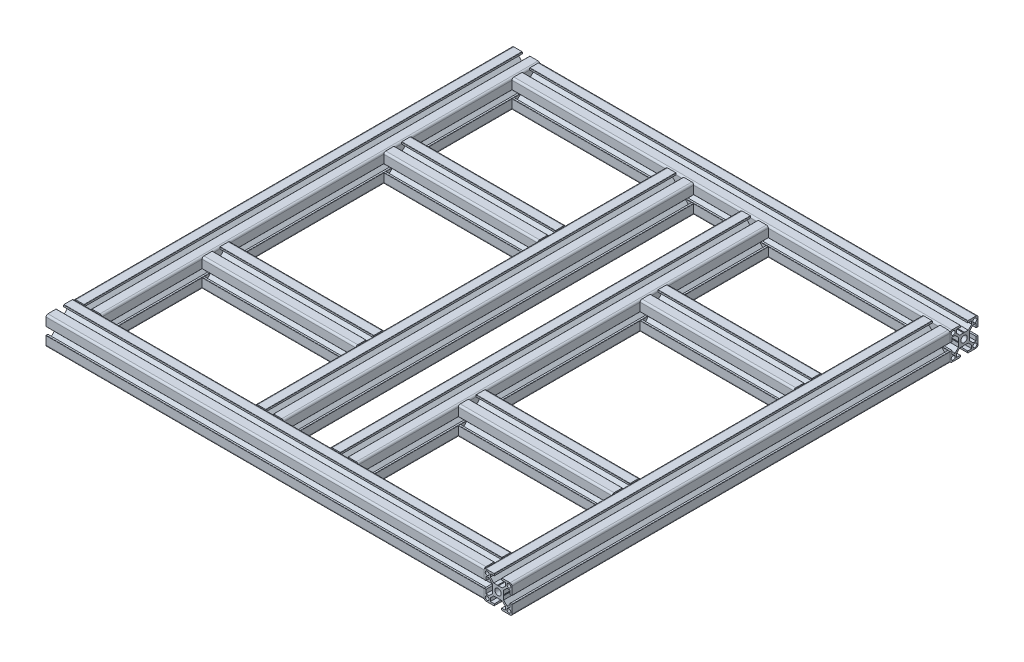
from build123d import *

# Parameters (mm, degrees)
F_30XS6_30X30S6_1_DEPTH      = 485
F_30XS6_30X30S6_1_DEPTH_BACK = 1
SKETCH_1_R                   = 2.1
SKETCH_1_R_2                 = 3.4
SKETCH_1_ON_SEGMENT_2_R      = 2.1
SKETCH_1_ON_SEGMENT_2_R_2    = 3.4
F_30XS6_30X30S6_1_2_DEPTH    = 486
SKETCH_1_ON_SEGMENT_3_R      = 2.1
SKETCH_1_ON_SEGMENT_3_R_2    = 3.4
F_30XS6_30X30S6_1_3_DEPTH    = 486
SKETCH_1_ON_SEGMENT_4_R      = 2.1
SKETCH_1_ON_SEGMENT_4_R_2    = 3.4
F_30XS6_30X30S6_1_4_DEPTH    = 486
SKETCH_1_ON_SEGMENT_5_R      = 2.1
SKETCH_1_ON_SEGMENT_5_R_2    = 3.4
F_30XS6_30X30S6_1_5_DEPTH    = 472
SKETCH_1_ON_SEGMENT_6_R      = 2.1
SKETCH_1_ON_SEGMENT_6_R_2    = 3.4
F_30XS6_30X30S6_1_6_DEPTH    = 472
SKETCH_1_ON_SEGMENT_7_R      = 2.1
SKETCH_1_ON_SEGMENT_7_R_2    = 3.4
F_30XS6_30X30S6_1_7_DEPTH    = 197
SKETCH_1_ON_SEGMENT_8_R      = 2.1
SKETCH_1_ON_SEGMENT_8_R_2    = 3.4
F_30XS6_30X30S6_1_8_DEPTH    = 197
SKETCH_1_ON_SEGMENT_9_R      = 2.1
SKETCH_1_ON_SEGMENT_9_R_2    = 3.4
F_30XS6_30X30S6_1_9_DEPTH    = 197
SKETCH_1_ON_SEGMENT_10_R     = 2.1
SKETCH_1_ON_SEGMENT_10_R_2   = 3.4
F_30XS6_30X30S6_1_10_DEPTH   = 197


with BuildPart() as part:
    # 草图1 → 30xs6 30X30S6(1) (new, two sides: drawn at the far end of the back side and taken through both)
    with BuildSketch(Plane(origin=(-235, 0, -235), x_dir=(0, 0, -1), z_dir=(1, 0, 0)).offset(-F_30XS6_30X30S6_1_DEPTH_BACK)):
        with BuildLine():
            Line((-14.7, 4), (-13, 4))
            Line((-13, 4), (-13, 8.25))
            Line((-13, 8.25), (-9.664213562, 8.25))
            Line((-9.664213562, 8.25), (-6, 4.585786438))
            Line((-6, 4.585786438), (-6, 0.519615242))
            Line((-6, 0.519615242), (-5.7, 0))
            Line((-5.7, 0), (-6, -0.519615242))
            Line((-6, -0.519615242), (-6, -4.585786438))
            Line((-6, -4.585786438), (-9.664213562, -8.25))
            Line((-9.664213562, -8.25), (-13, -8.25))
            Line((-13, -8.25), (-13, -4))
            Line((-13, -4), (-14.7, -4))
            ThreePointArc((-14.7, -4), (-14.912132034, -4.087867966), (-15, -4.3))
            Line((-15, -4.3), (-15, -13))
            ThreePointArc((-15, -13), (-14.414213562, -14.414213562), (-13, -15))
            Line((-13, -15), (-4.3, -15))
            ThreePointArc((-4.3, -15), (-4.087867966, -14.912132034), (-4, -14.7))
            Line((-4, -14.7), (-4, -13))
            Line((-4, -13), (-8.25, -13))
            Line((-8.25, -13), (-8.25, -9.664213562))
            Line((-8.25, -9.664213562), (-4.585786438, -6))
            Line((-4.585786438, -6), (-0.519615242, -6))
            Line((-0.519615242, -6), (0, -5.7))
            Line((0, -5.7), (0.519615242, -6))
            Line((0.519615242, -6), (4.585786438, -6))
            Line((4.585786438, -6), (8.25, -9.664213562))
            Line((8.25, -9.664213562), (8.25, -13))
            Line((8.25, -13), (4, -13))
            Line((4, -13), (4, -14.7))
            ThreePointArc((4, -14.7), (4.087867966, -14.912132034), (4.3, -15))
            Line((4.3, -15), (13, -15))
            ThreePointArc((13, -15), (14.414213562, -14.414213562), (15, -13))
            Line((15, -13), (15, -4.3))
            ThreePointArc((15, -4.3), (14.912132034, -4.087867966), (14.7, -4))
            Line((14.7, -4), (13, -4))
            Line((13, -4), (13, -8.25))
            Line((13, -8.25), (9.664213562, -8.25))
            Line((9.664213562, -8.25), (6, -4.585786438))
            Line((6, -4.585786438), (6, -0.519615242))
            Line((6, -0.519615242), (5.7, 0))
            Line((5.7, 0), (6, 0.519615242))
            Line((6, 0.519615242), (6, 4.585786438))
            Line((6, 4.585786438), (9.664213562, 8.25))
            Line((9.664213562, 8.25), (13, 8.25))
            Line((13, 8.25), (13, 4))
            Line((13, 4), (14.7, 4))
            ThreePointArc((14.7, 4), (14.912132034, 4.087867966), (15, 4.3))
            Line((15, 4.3), (15, 13))
            ThreePointArc((15, 13), (14.414213562, 14.414213562), (13, 15))
            Line((13, 15), (4.3, 15))
            ThreePointArc((4.3, 15), (4.087867966, 14.912132034), (4, 14.7))
            Line((4, 14.7), (4, 13))
            Line((4, 13), (8.25, 13))
            Line((8.25, 13), (8.25, 9.664213562))
            Line((8.25, 9.664213562), (4.585786438, 6))
            Line((4.585786438, 6), (0.519615242, 6))
            Line((0.519615242, 6), (0, 5.7))
            Line((0, 5.7), (-0.519615242, 6))
            Line((-0.519615242, 6), (-4.585786438, 6))
            Line((-4.585786438, 6), (-8.25, 9.664213562))
            Line((-8.25, 9.664213562), (-8.25, 13))
            Line((-8.25, 13), (-4, 13))
            Line((-4, 13), (-4, 14.7))
            ThreePointArc((-4, 14.7), (-4.087867966, 14.912132034), (-4.3, 15))
            Line((-4.3, 15), (-13, 15))
            ThreePointArc((-13, 15), (-14.414213562, 14.414213562), (-15, 13))
            Line((-15, 13), (-15, 4.3))
            ThreePointArc((-15, 4.3), (-14.912132034, 4.087867966), (-14.7, 4))
        make_face()
        with Locations((11.625, 11.625)):
            Circle(SKETCH_1_R, mode=Mode.SUBTRACT)
        with Locations((11.625, -11.625)):
            Circle(SKETCH_1_R, mode=Mode.SUBTRACT)
        Circle(SKETCH_1_R_2, mode=Mode.SUBTRACT)
        with Locations((-11.625, -11.625)):
            Circle(SKETCH_1_R, mode=Mode.SUBTRACT)
        with Locations((-11.625, 11.625)):
            Circle(SKETCH_1_R, mode=Mode.SUBTRACT)
    extrude(amount=F_30XS6_30X30S6_1_DEPTH + F_30XS6_30X30S6_1_DEPTH_BACK)

    # 30xs6 30X30S6(1) end butt 1
    split(bisect_by=Plane(origin=(-220, 0, -235), x_dir=(0, 1, 0), z_dir=(1, 0, 0)), keep=Keep.TOP)


with BuildPart() as body_2:
    # 草图1 on segment 2 (carried to segment 2) → 30xs6 30X30S6_1 2 (new body)
    with BuildSketch(Plane(origin=(235, 0, -236), x_dir=(1, 0, 0), z_dir=(0, 0, 1))):
        with BuildLine():
            Line((-14.7, 4), (-13, 4))
            Line((-13, 4), (-13, 8.25))
            Line((-13, 8.25), (-9.664213562, 8.25))
            Line((-9.664213562, 8.25), (-6, 4.585786438))
            Line((-6, 4.585786438), (-6, 0.519615242))
            Line((-6, 0.519615242), (-5.7, 0))
            Line((-5.7, 0), (-6, -0.519615242))
            Line((-6, -0.519615242), (-6, -4.585786438))
            Line((-6, -4.585786438), (-9.664213562, -8.25))
            Line((-9.664213562, -8.25), (-13, -8.25))
            Line((-13, -8.25), (-13, -4))
            Line((-13, -4), (-14.7, -4))
            ThreePointArc((-14.7, -4), (-14.912132034, -4.087867966), (-15, -4.3))
            Line((-15, -4.3), (-15, -13))
            ThreePointArc((-15, -13), (-14.414213562, -14.414213562), (-13, -15))
            Line((-13, -15), (-4.3, -15))
            ThreePointArc((-4.3, -15), (-4.087867966, -14.912132034), (-4, -14.7))
            Line((-4, -14.7), (-4, -13))
            Line((-4, -13), (-8.25, -13))
            Line((-8.25, -13), (-8.25, -9.664213562))
            Line((-8.25, -9.664213562), (-4.585786438, -6))
            Line((-4.585786438, -6), (-0.519615242, -6))
            Line((-0.519615242, -6), (0, -5.7))
            Line((0, -5.7), (0.519615242, -6))
            Line((0.519615242, -6), (4.585786438, -6))
            Line((4.585786438, -6), (8.25, -9.664213562))
            Line((8.25, -9.664213562), (8.25, -13))
            Line((8.25, -13), (4, -13))
            Line((4, -13), (4, -14.7))
            ThreePointArc((4, -14.7), (4.087867966, -14.912132034), (4.3, -15))
            Line((4.3, -15), (13, -15))
            ThreePointArc((13, -15), (14.414213562, -14.414213562), (15, -13))
            Line((15, -13), (15, -4.3))
            ThreePointArc((15, -4.3), (14.912132034, -4.087867966), (14.7, -4))
            Line((14.7, -4), (13, -4))
            Line((13, -4), (13, -8.25))
            Line((13, -8.25), (9.664213562, -8.25))
            Line((9.664213562, -8.25), (6, -4.585786438))
            Line((6, -4.585786438), (6, -0.519615242))
            Line((6, -0.519615242), (5.7, 0))
            Line((5.7, 0), (6, 0.519615242))
            Line((6, 0.519615242), (6, 4.585786438))
            Line((6, 4.585786438), (9.664213562, 8.25))
            Line((9.664213562, 8.25), (13, 8.25))
            Line((13, 8.25), (13, 4))
            Line((13, 4), (14.7, 4))
            ThreePointArc((14.7, 4), (14.912132034, 4.087867966), (15, 4.3))
            Line((15, 4.3), (15, 13))
            ThreePointArc((15, 13), (14.414213562, 14.414213562), (13, 15))
            Line((13, 15), (4.3, 15))
            ThreePointArc((4.3, 15), (4.087867966, 14.912132034), (4, 14.7))
            Line((4, 14.7), (4, 13))
            Line((4, 13), (8.25, 13))
            Line((8.25, 13), (8.25, 9.664213562))
            Line((8.25, 9.664213562), (4.585786438, 6))
            Line((4.585786438, 6), (0.519615242, 6))
            Line((0.519615242, 6), (0, 5.7))
            Line((0, 5.7), (-0.519615242, 6))
            Line((-0.519615242, 6), (-4.585786438, 6))
            Line((-4.585786438, 6), (-8.25, 9.664213562))
            Line((-8.25, 9.664213562), (-8.25, 13))
            Line((-8.25, 13), (-4, 13))
            Line((-4, 13), (-4, 14.7))
            ThreePointArc((-4, 14.7), (-4.087867966, 14.912132034), (-4.3, 15))
            Line((-4.3, 15), (-13, 15))
            ThreePointArc((-13, 15), (-14.414213562, 14.414213562), (-15, 13))
            Line((-15, 13), (-15, 4.3))
            ThreePointArc((-15, 4.3), (-14.912132034, 4.087867966), (-14.7, 4))
        make_face()
        with Locations((11.625, 11.625)):
            Circle(SKETCH_1_ON_SEGMENT_2_R, mode=Mode.SUBTRACT)
        with Locations((11.625, -11.625)):
            Circle(SKETCH_1_ON_SEGMENT_2_R, mode=Mode.SUBTRACT)
        Circle(SKETCH_1_ON_SEGMENT_2_R_2, mode=Mode.SUBTRACT)
        with Locations((-11.625, -11.625)):
            Circle(SKETCH_1_ON_SEGMENT_2_R, mode=Mode.SUBTRACT)
        with Locations((-11.625, 11.625)):
            Circle(SKETCH_1_ON_SEGMENT_2_R, mode=Mode.SUBTRACT)
    extrude(amount=F_30XS6_30X30S6_1_2_DEPTH)

    # 30xs6 30X30S6_1 2 end butt 1
    split(bisect_by=Plane(origin=(235, 0, -220), x_dir=(0, -1, 0), z_dir=(0, 0, 1)), keep=Keep.TOP)


with BuildPart() as body_3:
    # 草图1 on segment 3 (carried to segment 3) → 30xs6 30X30S6_1 3 (new body)
    with BuildSketch(Plane(origin=(236, 0, 235), x_dir=(0, 0, 1), z_dir=(-1, 0, 0))):
        with BuildLine():
            Line((-14.7, 4), (-13, 4))
            Line((-13, 4), (-13, 8.25))
            Line((-13, 8.25), (-9.664213562, 8.25))
            Line((-9.664213562, 8.25), (-6, 4.585786438))
            Line((-6, 4.585786438), (-6, 0.519615242))
            Line((-6, 0.519615242), (-5.7, 0))
            Line((-5.7, 0), (-6, -0.519615242))
            Line((-6, -0.519615242), (-6, -4.585786438))
            Line((-6, -4.585786438), (-9.664213562, -8.25))
            Line((-9.664213562, -8.25), (-13, -8.25))
            Line((-13, -8.25), (-13, -4))
            Line((-13, -4), (-14.7, -4))
            ThreePointArc((-14.7, -4), (-14.912132034, -4.087867966), (-15, -4.3))
            Line((-15, -4.3), (-15, -13))
            ThreePointArc((-15, -13), (-14.414213562, -14.414213562), (-13, -15))
            Line((-13, -15), (-4.3, -15))
            ThreePointArc((-4.3, -15), (-4.087867966, -14.912132034), (-4, -14.7))
            Line((-4, -14.7), (-4, -13))
            Line((-4, -13), (-8.25, -13))
            Line((-8.25, -13), (-8.25, -9.664213562))
            Line((-8.25, -9.664213562), (-4.585786438, -6))
            Line((-4.585786438, -6), (-0.519615242, -6))
            Line((-0.519615242, -6), (0, -5.7))
            Line((0, -5.7), (0.519615242, -6))
            Line((0.519615242, -6), (4.585786438, -6))
            Line((4.585786438, -6), (8.25, -9.664213562))
            Line((8.25, -9.664213562), (8.25, -13))
            Line((8.25, -13), (4, -13))
            Line((4, -13), (4, -14.7))
            ThreePointArc((4, -14.7), (4.087867966, -14.912132034), (4.3, -15))
            Line((4.3, -15), (13, -15))
            ThreePointArc((13, -15), (14.414213562, -14.414213562), (15, -13))
            Line((15, -13), (15, -4.3))
            ThreePointArc((15, -4.3), (14.912132034, -4.087867966), (14.7, -4))
            Line((14.7, -4), (13, -4))
            Line((13, -4), (13, -8.25))
            Line((13, -8.25), (9.664213562, -8.25))
            Line((9.664213562, -8.25), (6, -4.585786438))
            Line((6, -4.585786438), (6, -0.519615242))
            Line((6, -0.519615242), (5.7, 0))
            Line((5.7, 0), (6, 0.519615242))
            Line((6, 0.519615242), (6, 4.585786438))
            Line((6, 4.585786438), (9.664213562, 8.25))
            Line((9.664213562, 8.25), (13, 8.25))
            Line((13, 8.25), (13, 4))
            Line((13, 4), (14.7, 4))
            ThreePointArc((14.7, 4), (14.912132034, 4.087867966), (15, 4.3))
            Line((15, 4.3), (15, 13))
            ThreePointArc((15, 13), (14.414213562, 14.414213562), (13, 15))
            Line((13, 15), (4.3, 15))
            ThreePointArc((4.3, 15), (4.087867966, 14.912132034), (4, 14.7))
            Line((4, 14.7), (4, 13))
            Line((4, 13), (8.25, 13))
            Line((8.25, 13), (8.25, 9.664213562))
            Line((8.25, 9.664213562), (4.585786438, 6))
            Line((4.585786438, 6), (0.519615242, 6))
            Line((0.519615242, 6), (0, 5.7))
            Line((0, 5.7), (-0.519615242, 6))
            Line((-0.519615242, 6), (-4.585786438, 6))
            Line((-4.585786438, 6), (-8.25, 9.664213562))
            Line((-8.25, 9.664213562), (-8.25, 13))
            Line((-8.25, 13), (-4, 13))
            Line((-4, 13), (-4, 14.7))
            ThreePointArc((-4, 14.7), (-4.087867966, 14.912132034), (-4.3, 15))
            Line((-4.3, 15), (-13, 15))
            ThreePointArc((-13, 15), (-14.414213562, 14.414213562), (-15, 13))
            Line((-15, 13), (-15, 4.3))
            ThreePointArc((-15, 4.3), (-14.912132034, 4.087867966), (-14.7, 4))
        make_face()
        with Locations((11.625, 11.625)):
            Circle(SKETCH_1_ON_SEGMENT_3_R, mode=Mode.SUBTRACT)
        with Locations((11.625, -11.625)):
            Circle(SKETCH_1_ON_SEGMENT_3_R, mode=Mode.SUBTRACT)
        Circle(SKETCH_1_ON_SEGMENT_3_R_2, mode=Mode.SUBTRACT)
        with Locations((-11.625, -11.625)):
            Circle(SKETCH_1_ON_SEGMENT_3_R, mode=Mode.SUBTRACT)
        with Locations((-11.625, 11.625)):
            Circle(SKETCH_1_ON_SEGMENT_3_R, mode=Mode.SUBTRACT)
    extrude(amount=F_30XS6_30X30S6_1_3_DEPTH)

    # 30xs6 30X30S6_1 3 end butt 1
    split(bisect_by=Plane(origin=(220, 0, 235), x_dir=(0, -1, 0), z_dir=(-1, 0, 0)), keep=Keep.TOP)


with BuildPart() as body_4:
    # 草图1 on segment 4 (carried to segment 4) → 30xs6 30X30S6_1 4 (new body)
    with BuildSketch(Plane(origin=(-235, 0, 236), x_dir=(-1, 0, 0), z_dir=(0, 0, -1))):
        with BuildLine():
            Line((-14.7, 4), (-13, 4))
            Line((-13, 4), (-13, 8.25))
            Line((-13, 8.25), (-9.664213562, 8.25))
            Line((-9.664213562, 8.25), (-6, 4.585786438))
            Line((-6, 4.585786438), (-6, 0.519615242))
            Line((-6, 0.519615242), (-5.7, 0))
            Line((-5.7, 0), (-6, -0.519615242))
            Line((-6, -0.519615242), (-6, -4.585786438))
            Line((-6, -4.585786438), (-9.664213562, -8.25))
            Line((-9.664213562, -8.25), (-13, -8.25))
            Line((-13, -8.25), (-13, -4))
            Line((-13, -4), (-14.7, -4))
            ThreePointArc((-14.7, -4), (-14.912132034, -4.087867966), (-15, -4.3))
            Line((-15, -4.3), (-15, -13))
            ThreePointArc((-15, -13), (-14.414213562, -14.414213562), (-13, -15))
            Line((-13, -15), (-4.3, -15))
            ThreePointArc((-4.3, -15), (-4.087867966, -14.912132034), (-4, -14.7))
            Line((-4, -14.7), (-4, -13))
            Line((-4, -13), (-8.25, -13))
            Line((-8.25, -13), (-8.25, -9.664213562))
            Line((-8.25, -9.664213562), (-4.585786438, -6))
            Line((-4.585786438, -6), (-0.519615242, -6))
            Line((-0.519615242, -6), (0, -5.7))
            Line((0, -5.7), (0.519615242, -6))
            Line((0.519615242, -6), (4.585786438, -6))
            Line((4.585786438, -6), (8.25, -9.664213562))
            Line((8.25, -9.664213562), (8.25, -13))
            Line((8.25, -13), (4, -13))
            Line((4, -13), (4, -14.7))
            ThreePointArc((4, -14.7), (4.087867966, -14.912132034), (4.3, -15))
            Line((4.3, -15), (13, -15))
            ThreePointArc((13, -15), (14.414213562, -14.414213562), (15, -13))
            Line((15, -13), (15, -4.3))
            ThreePointArc((15, -4.3), (14.912132034, -4.087867966), (14.7, -4))
            Line((14.7, -4), (13, -4))
            Line((13, -4), (13, -8.25))
            Line((13, -8.25), (9.664213562, -8.25))
            Line((9.664213562, -8.25), (6, -4.585786438))
            Line((6, -4.585786438), (6, -0.519615242))
            Line((6, -0.519615242), (5.7, 0))
            Line((5.7, 0), (6, 0.519615242))
            Line((6, 0.519615242), (6, 4.585786438))
            Line((6, 4.585786438), (9.664213562, 8.25))
            Line((9.664213562, 8.25), (13, 8.25))
            Line((13, 8.25), (13, 4))
            Line((13, 4), (14.7, 4))
            ThreePointArc((14.7, 4), (14.912132034, 4.087867966), (15, 4.3))
            Line((15, 4.3), (15, 13))
            ThreePointArc((15, 13), (14.414213562, 14.414213562), (13, 15))
            Line((13, 15), (4.3, 15))
            ThreePointArc((4.3, 15), (4.087867966, 14.912132034), (4, 14.7))
            Line((4, 14.7), (4, 13))
            Line((4, 13), (8.25, 13))
            Line((8.25, 13), (8.25, 9.664213562))
            Line((8.25, 9.664213562), (4.585786438, 6))
            Line((4.585786438, 6), (0.519615242, 6))
            Line((0.519615242, 6), (0, 5.7))
            Line((0, 5.7), (-0.519615242, 6))
            Line((-0.519615242, 6), (-4.585786438, 6))
            Line((-4.585786438, 6), (-8.25, 9.664213562))
            Line((-8.25, 9.664213562), (-8.25, 13))
            Line((-8.25, 13), (-4, 13))
            Line((-4, 13), (-4, 14.7))
            ThreePointArc((-4, 14.7), (-4.087867966, 14.912132034), (-4.3, 15))
            Line((-4.3, 15), (-13, 15))
            ThreePointArc((-13, 15), (-14.414213562, 14.414213562), (-15, 13))
            Line((-15, 13), (-15, 4.3))
            ThreePointArc((-15, 4.3), (-14.912132034, 4.087867966), (-14.7, 4))
        make_face()
        with Locations((11.625, 11.625)):
            Circle(SKETCH_1_ON_SEGMENT_4_R, mode=Mode.SUBTRACT)
        with Locations((11.625, -11.625)):
            Circle(SKETCH_1_ON_SEGMENT_4_R, mode=Mode.SUBTRACT)
        Circle(SKETCH_1_ON_SEGMENT_4_R_2, mode=Mode.SUBTRACT)
        with Locations((-11.625, -11.625)):
            Circle(SKETCH_1_ON_SEGMENT_4_R, mode=Mode.SUBTRACT)
        with Locations((-11.625, 11.625)):
            Circle(SKETCH_1_ON_SEGMENT_4_R, mode=Mode.SUBTRACT)
    extrude(amount=F_30XS6_30X30S6_1_4_DEPTH)

    # 30xs6 30X30S6_1 4 end butt 1
    split(bisect_by=Plane(origin=(-235, 0, 220), x_dir=(0, 1, 0), z_dir=(0, 0, -1)), keep=Keep.TOP)


with BuildPart() as body_5:
    # 草图1 on segment 5 (carried to segment 5) → 30xs6 30X30S6_1 5 (new body)
    with BuildSketch(Plane(origin=(-40, 0, -236), x_dir=(1, 0, 0), z_dir=(0, 0, 1))):
        with BuildLine():
            Line((-14.7, 4), (-13, 4))
            Line((-13, 4), (-13, 8.25))
            Line((-13, 8.25), (-9.664213562, 8.25))
            Line((-9.664213562, 8.25), (-6, 4.585786438))
            Line((-6, 4.585786438), (-6, 0.519615242))
            Line((-6, 0.519615242), (-5.7, 0))
            Line((-5.7, 0), (-6, -0.519615242))
            Line((-6, -0.519615242), (-6, -4.585786438))
            Line((-6, -4.585786438), (-9.664213562, -8.25))
            Line((-9.664213562, -8.25), (-13, -8.25))
            Line((-13, -8.25), (-13, -4))
            Line((-13, -4), (-14.7, -4))
            ThreePointArc((-14.7, -4), (-14.912132034, -4.087867966), (-15, -4.3))
            Line((-15, -4.3), (-15, -13))
            ThreePointArc((-15, -13), (-14.414213562, -14.414213562), (-13, -15))
            Line((-13, -15), (-4.3, -15))
            ThreePointArc((-4.3, -15), (-4.087867966, -14.912132034), (-4, -14.7))
            Line((-4, -14.7), (-4, -13))
            Line((-4, -13), (-8.25, -13))
            Line((-8.25, -13), (-8.25, -9.664213562))
            Line((-8.25, -9.664213562), (-4.585786438, -6))
            Line((-4.585786438, -6), (-0.519615242, -6))
            Line((-0.519615242, -6), (0, -5.7))
            Line((0, -5.7), (0.519615242, -6))
            Line((0.519615242, -6), (4.585786438, -6))
            Line((4.585786438, -6), (8.25, -9.664213562))
            Line((8.25, -9.664213562), (8.25, -13))
            Line((8.25, -13), (4, -13))
            Line((4, -13), (4, -14.7))
            ThreePointArc((4, -14.7), (4.087867966, -14.912132034), (4.3, -15))
            Line((4.3, -15), (13, -15))
            ThreePointArc((13, -15), (14.414213562, -14.414213562), (15, -13))
            Line((15, -13), (15, -4.3))
            ThreePointArc((15, -4.3), (14.912132034, -4.087867966), (14.7, -4))
            Line((14.7, -4), (13, -4))
            Line((13, -4), (13, -8.25))
            Line((13, -8.25), (9.664213562, -8.25))
            Line((9.664213562, -8.25), (6, -4.585786438))
            Line((6, -4.585786438), (6, -0.519615242))
            Line((6, -0.519615242), (5.7, 0))
            Line((5.7, 0), (6, 0.519615242))
            Line((6, 0.519615242), (6, 4.585786438))
            Line((6, 4.585786438), (9.664213562, 8.25))
            Line((9.664213562, 8.25), (13, 8.25))
            Line((13, 8.25), (13, 4))
            Line((13, 4), (14.7, 4))
            ThreePointArc((14.7, 4), (14.912132034, 4.087867966), (15, 4.3))
            Line((15, 4.3), (15, 13))
            ThreePointArc((15, 13), (14.414213562, 14.414213562), (13, 15))
            Line((13, 15), (4.3, 15))
            ThreePointArc((4.3, 15), (4.087867966, 14.912132034), (4, 14.7))
            Line((4, 14.7), (4, 13))
            Line((4, 13), (8.25, 13))
            Line((8.25, 13), (8.25, 9.664213562))
            Line((8.25, 9.664213562), (4.585786438, 6))
            Line((4.585786438, 6), (0.519615242, 6))
            Line((0.519615242, 6), (0, 5.7))
            Line((0, 5.7), (-0.519615242, 6))
            Line((-0.519615242, 6), (-4.585786438, 6))
            Line((-4.585786438, 6), (-8.25, 9.664213562))
            Line((-8.25, 9.664213562), (-8.25, 13))
            Line((-8.25, 13), (-4, 13))
            Line((-4, 13), (-4, 14.7))
            ThreePointArc((-4, 14.7), (-4.087867966, 14.912132034), (-4.3, 15))
            Line((-4.3, 15), (-13, 15))
            ThreePointArc((-13, 15), (-14.414213562, 14.414213562), (-15, 13))
            Line((-15, 13), (-15, 4.3))
            ThreePointArc((-15, 4.3), (-14.912132034, 4.087867966), (-14.7, 4))
        make_face()
        with Locations((11.625, 11.625)):
            Circle(SKETCH_1_ON_SEGMENT_5_R, mode=Mode.SUBTRACT)
        with Locations((11.625, -11.625)):
            Circle(SKETCH_1_ON_SEGMENT_5_R, mode=Mode.SUBTRACT)
        Circle(SKETCH_1_ON_SEGMENT_5_R_2, mode=Mode.SUBTRACT)
        with Locations((-11.625, -11.625)):
            Circle(SKETCH_1_ON_SEGMENT_5_R, mode=Mode.SUBTRACT)
        with Locations((-11.625, 11.625)):
            Circle(SKETCH_1_ON_SEGMENT_5_R, mode=Mode.SUBTRACT)
    extrude(amount=F_30XS6_30X30S6_1_5_DEPTH)

    # 30xs6 30X30S6_1 5 end butt 1
    split(bisect_by=Plane(origin=(-40, 0, -220), x_dir=(0, -1, 0), z_dir=(0, 0, 1)), keep=Keep.TOP)

    # 30xs6 30X30S6_1 5 end butt 2
    split(bisect_by=Plane(origin=(-40, 0, 220), x_dir=(0, 1, 0), z_dir=(0, 0, -1)), keep=Keep.TOP)


with BuildPart() as body_6:
    # 草图1 on segment 6 (carried to segment 6) → 30xs6 30X30S6_1 6 (new body)
    with BuildSketch(Plane(origin=(40, 0, -236), x_dir=(1, 0, 0), z_dir=(0, 0, 1))):
        with BuildLine():
            Line((-14.7, 4), (-13, 4))
            Line((-13, 4), (-13, 8.25))
            Line((-13, 8.25), (-9.664213562, 8.25))
            Line((-9.664213562, 8.25), (-6, 4.585786438))
            Line((-6, 4.585786438), (-6, 0.519615242))
            Line((-6, 0.519615242), (-5.7, 0))
            Line((-5.7, 0), (-6, -0.519615242))
            Line((-6, -0.519615242), (-6, -4.585786438))
            Line((-6, -4.585786438), (-9.664213562, -8.25))
            Line((-9.664213562, -8.25), (-13, -8.25))
            Line((-13, -8.25), (-13, -4))
            Line((-13, -4), (-14.7, -4))
            ThreePointArc((-14.7, -4), (-14.912132034, -4.087867966), (-15, -4.3))
            Line((-15, -4.3), (-15, -13))
            ThreePointArc((-15, -13), (-14.414213562, -14.414213562), (-13, -15))
            Line((-13, -15), (-4.3, -15))
            ThreePointArc((-4.3, -15), (-4.087867966, -14.912132034), (-4, -14.7))
            Line((-4, -14.7), (-4, -13))
            Line((-4, -13), (-8.25, -13))
            Line((-8.25, -13), (-8.25, -9.664213562))
            Line((-8.25, -9.664213562), (-4.585786438, -6))
            Line((-4.585786438, -6), (-0.519615242, -6))
            Line((-0.519615242, -6), (0, -5.7))
            Line((0, -5.7), (0.519615242, -6))
            Line((0.519615242, -6), (4.585786438, -6))
            Line((4.585786438, -6), (8.25, -9.664213562))
            Line((8.25, -9.664213562), (8.25, -13))
            Line((8.25, -13), (4, -13))
            Line((4, -13), (4, -14.7))
            ThreePointArc((4, -14.7), (4.087867966, -14.912132034), (4.3, -15))
            Line((4.3, -15), (13, -15))
            ThreePointArc((13, -15), (14.414213562, -14.414213562), (15, -13))
            Line((15, -13), (15, -4.3))
            ThreePointArc((15, -4.3), (14.912132034, -4.087867966), (14.7, -4))
            Line((14.7, -4), (13, -4))
            Line((13, -4), (13, -8.25))
            Line((13, -8.25), (9.664213562, -8.25))
            Line((9.664213562, -8.25), (6, -4.585786438))
            Line((6, -4.585786438), (6, -0.519615242))
            Line((6, -0.519615242), (5.7, 0))
            Line((5.7, 0), (6, 0.519615242))
            Line((6, 0.519615242), (6, 4.585786438))
            Line((6, 4.585786438), (9.664213562, 8.25))
            Line((9.664213562, 8.25), (13, 8.25))
            Line((13, 8.25), (13, 4))
            Line((13, 4), (14.7, 4))
            ThreePointArc((14.7, 4), (14.912132034, 4.087867966), (15, 4.3))
            Line((15, 4.3), (15, 13))
            ThreePointArc((15, 13), (14.414213562, 14.414213562), (13, 15))
            Line((13, 15), (4.3, 15))
            ThreePointArc((4.3, 15), (4.087867966, 14.912132034), (4, 14.7))
            Line((4, 14.7), (4, 13))
            Line((4, 13), (8.25, 13))
            Line((8.25, 13), (8.25, 9.664213562))
            Line((8.25, 9.664213562), (4.585786438, 6))
            Line((4.585786438, 6), (0.519615242, 6))
            Line((0.519615242, 6), (0, 5.7))
            Line((0, 5.7), (-0.519615242, 6))
            Line((-0.519615242, 6), (-4.585786438, 6))
            Line((-4.585786438, 6), (-8.25, 9.664213562))
            Line((-8.25, 9.664213562), (-8.25, 13))
            Line((-8.25, 13), (-4, 13))
            Line((-4, 13), (-4, 14.7))
            ThreePointArc((-4, 14.7), (-4.087867966, 14.912132034), (-4.3, 15))
            Line((-4.3, 15), (-13, 15))
            ThreePointArc((-13, 15), (-14.414213562, 14.414213562), (-15, 13))
            Line((-15, 13), (-15, 4.3))
            ThreePointArc((-15, 4.3), (-14.912132034, 4.087867966), (-14.7, 4))
        make_face()
        with Locations((11.625, 11.625)):
            Circle(SKETCH_1_ON_SEGMENT_6_R, mode=Mode.SUBTRACT)
        with Locations((11.625, -11.625)):
            Circle(SKETCH_1_ON_SEGMENT_6_R, mode=Mode.SUBTRACT)
        Circle(SKETCH_1_ON_SEGMENT_6_R_2, mode=Mode.SUBTRACT)
        with Locations((-11.625, -11.625)):
            Circle(SKETCH_1_ON_SEGMENT_6_R, mode=Mode.SUBTRACT)
        with Locations((-11.625, 11.625)):
            Circle(SKETCH_1_ON_SEGMENT_6_R, mode=Mode.SUBTRACT)
    extrude(amount=F_30XS6_30X30S6_1_6_DEPTH)

    # 30xs6 30X30S6_1 6 end butt 1
    split(bisect_by=Plane(origin=(40, 0, -220), x_dir=(0, -1, 0), z_dir=(0, 0, 1)), keep=Keep.TOP)

    # 30xs6 30X30S6_1 6 end butt 2
    split(bisect_by=Plane(origin=(40, 0, 220), x_dir=(0, 1, 0), z_dir=(0, 0, -1)), keep=Keep.TOP)


with BuildPart() as body_7:
    # 草图1 on segment 7 (carried to segment 7) → 30xs6 30X30S6_1 7 (new body)
    with BuildSketch(Plane(origin=(-236, 0, -97.5), x_dir=(0, 0, -1), z_dir=(1, 0, 0))):
        with BuildLine():
            Line((-14.7, 4), (-13, 4))
            Line((-13, 4), (-13, 8.25))
            Line((-13, 8.25), (-9.664213562, 8.25))
            Line((-9.664213562, 8.25), (-6, 4.585786438))
            Line((-6, 4.585786438), (-6, 0.519615242))
            Line((-6, 0.519615242), (-5.7, 0))
            Line((-5.7, 0), (-6, -0.519615242))
            Line((-6, -0.519615242), (-6, -4.585786438))
            Line((-6, -4.585786438), (-9.664213562, -8.25))
            Line((-9.664213562, -8.25), (-13, -8.25))
            Line((-13, -8.25), (-13, -4))
            Line((-13, -4), (-14.7, -4))
            ThreePointArc((-14.7, -4), (-14.912132034, -4.087867966), (-15, -4.3))
            Line((-15, -4.3), (-15, -13))
            ThreePointArc((-15, -13), (-14.414213562, -14.414213562), (-13, -15))
            Line((-13, -15), (-4.3, -15))
            ThreePointArc((-4.3, -15), (-4.087867966, -14.912132034), (-4, -14.7))
            Line((-4, -14.7), (-4, -13))
            Line((-4, -13), (-8.25, -13))
            Line((-8.25, -13), (-8.25, -9.664213562))
            Line((-8.25, -9.664213562), (-4.585786438, -6))
            Line((-4.585786438, -6), (-0.519615242, -6))
            Line((-0.519615242, -6), (0, -5.7))
            Line((0, -5.7), (0.519615242, -6))
            Line((0.519615242, -6), (4.585786438, -6))
            Line((4.585786438, -6), (8.25, -9.664213562))
            Line((8.25, -9.664213562), (8.25, -13))
            Line((8.25, -13), (4, -13))
            Line((4, -13), (4, -14.7))
            ThreePointArc((4, -14.7), (4.087867966, -14.912132034), (4.3, -15))
            Line((4.3, -15), (13, -15))
            ThreePointArc((13, -15), (14.414213562, -14.414213562), (15, -13))
            Line((15, -13), (15, -4.3))
            ThreePointArc((15, -4.3), (14.912132034, -4.087867966), (14.7, -4))
            Line((14.7, -4), (13, -4))
            Line((13, -4), (13, -8.25))
            Line((13, -8.25), (9.664213562, -8.25))
            Line((9.664213562, -8.25), (6, -4.585786438))
            Line((6, -4.585786438), (6, -0.519615242))
            Line((6, -0.519615242), (5.7, 0))
            Line((5.7, 0), (6, 0.519615242))
            Line((6, 0.519615242), (6, 4.585786438))
            Line((6, 4.585786438), (9.664213562, 8.25))
            Line((9.664213562, 8.25), (13, 8.25))
            Line((13, 8.25), (13, 4))
            Line((13, 4), (14.7, 4))
            ThreePointArc((14.7, 4), (14.912132034, 4.087867966), (15, 4.3))
            Line((15, 4.3), (15, 13))
            ThreePointArc((15, 13), (14.414213562, 14.414213562), (13, 15))
            Line((13, 15), (4.3, 15))
            ThreePointArc((4.3, 15), (4.087867966, 14.912132034), (4, 14.7))
            Line((4, 14.7), (4, 13))
            Line((4, 13), (8.25, 13))
            Line((8.25, 13), (8.25, 9.664213562))
            Line((8.25, 9.664213562), (4.585786438, 6))
            Line((4.585786438, 6), (0.519615242, 6))
            Line((0.519615242, 6), (0, 5.7))
            Line((0, 5.7), (-0.519615242, 6))
            Line((-0.519615242, 6), (-4.585786438, 6))
            Line((-4.585786438, 6), (-8.25, 9.664213562))
            Line((-8.25, 9.664213562), (-8.25, 13))
            Line((-8.25, 13), (-4, 13))
            Line((-4, 13), (-4, 14.7))
            ThreePointArc((-4, 14.7), (-4.087867966, 14.912132034), (-4.3, 15))
            Line((-4.3, 15), (-13, 15))
            ThreePointArc((-13, 15), (-14.414213562, 14.414213562), (-15, 13))
            Line((-15, 13), (-15, 4.3))
            ThreePointArc((-15, 4.3), (-14.912132034, 4.087867966), (-14.7, 4))
        make_face()
        with Locations((11.625, 11.625)):
            Circle(SKETCH_1_ON_SEGMENT_7_R, mode=Mode.SUBTRACT)
        with Locations((11.625, -11.625)):
            Circle(SKETCH_1_ON_SEGMENT_7_R, mode=Mode.SUBTRACT)
        Circle(SKETCH_1_ON_SEGMENT_7_R_2, mode=Mode.SUBTRACT)
        with Locations((-11.625, -11.625)):
            Circle(SKETCH_1_ON_SEGMENT_7_R, mode=Mode.SUBTRACT)
        with Locations((-11.625, 11.625)):
            Circle(SKETCH_1_ON_SEGMENT_7_R, mode=Mode.SUBTRACT)
    extrude(amount=F_30XS6_30X30S6_1_7_DEPTH)

    # 30xs6 30X30S6_1 7 end butt 1
    split(bisect_by=Plane(origin=(-220, 0, -97.5), x_dir=(0, 1, 0), z_dir=(1, 0, 0)), keep=Keep.TOP)

    # 30xs6 30X30S6_1 7 end butt 2
    split(bisect_by=Plane(origin=(-55, 0, -97.5), x_dir=(0, -1, 0), z_dir=(-1, 0, 0)), keep=Keep.TOP)


with BuildPart() as body_8:
    # 草图1 on segment 8 (carried to segment 8) → 30xs6 30X30S6_1 8 (new body)
    with BuildSketch(Plane(origin=(-236, 0, 97.5), x_dir=(0, 0, -1), z_dir=(1, 0, 0))):
        with BuildLine():
            Line((-14.7, 4), (-13, 4))
            Line((-13, 4), (-13, 8.25))
            Line((-13, 8.25), (-9.664213562, 8.25))
            Line((-9.664213562, 8.25), (-6, 4.585786438))
            Line((-6, 4.585786438), (-6, 0.519615242))
            Line((-6, 0.519615242), (-5.7, 0))
            Line((-5.7, 0), (-6, -0.519615242))
            Line((-6, -0.519615242), (-6, -4.585786438))
            Line((-6, -4.585786438), (-9.664213562, -8.25))
            Line((-9.664213562, -8.25), (-13, -8.25))
            Line((-13, -8.25), (-13, -4))
            Line((-13, -4), (-14.7, -4))
            ThreePointArc((-14.7, -4), (-14.912132034, -4.087867966), (-15, -4.3))
            Line((-15, -4.3), (-15, -13))
            ThreePointArc((-15, -13), (-14.414213562, -14.414213562), (-13, -15))
            Line((-13, -15), (-4.3, -15))
            ThreePointArc((-4.3, -15), (-4.087867966, -14.912132034), (-4, -14.7))
            Line((-4, -14.7), (-4, -13))
            Line((-4, -13), (-8.25, -13))
            Line((-8.25, -13), (-8.25, -9.664213562))
            Line((-8.25, -9.664213562), (-4.585786438, -6))
            Line((-4.585786438, -6), (-0.519615242, -6))
            Line((-0.519615242, -6), (0, -5.7))
            Line((0, -5.7), (0.519615242, -6))
            Line((0.519615242, -6), (4.585786438, -6))
            Line((4.585786438, -6), (8.25, -9.664213562))
            Line((8.25, -9.664213562), (8.25, -13))
            Line((8.25, -13), (4, -13))
            Line((4, -13), (4, -14.7))
            ThreePointArc((4, -14.7), (4.087867966, -14.912132034), (4.3, -15))
            Line((4.3, -15), (13, -15))
            ThreePointArc((13, -15), (14.414213562, -14.414213562), (15, -13))
            Line((15, -13), (15, -4.3))
            ThreePointArc((15, -4.3), (14.912132034, -4.087867966), (14.7, -4))
            Line((14.7, -4), (13, -4))
            Line((13, -4), (13, -8.25))
            Line((13, -8.25), (9.664213562, -8.25))
            Line((9.664213562, -8.25), (6, -4.585786438))
            Line((6, -4.585786438), (6, -0.519615242))
            Line((6, -0.519615242), (5.7, 0))
            Line((5.7, 0), (6, 0.519615242))
            Line((6, 0.519615242), (6, 4.585786438))
            Line((6, 4.585786438), (9.664213562, 8.25))
            Line((9.664213562, 8.25), (13, 8.25))
            Line((13, 8.25), (13, 4))
            Line((13, 4), (14.7, 4))
            ThreePointArc((14.7, 4), (14.912132034, 4.087867966), (15, 4.3))
            Line((15, 4.3), (15, 13))
            ThreePointArc((15, 13), (14.414213562, 14.414213562), (13, 15))
            Line((13, 15), (4.3, 15))
            ThreePointArc((4.3, 15), (4.087867966, 14.912132034), (4, 14.7))
            Line((4, 14.7), (4, 13))
            Line((4, 13), (8.25, 13))
            Line((8.25, 13), (8.25, 9.664213562))
            Line((8.25, 9.664213562), (4.585786438, 6))
            Line((4.585786438, 6), (0.519615242, 6))
            Line((0.519615242, 6), (0, 5.7))
            Line((0, 5.7), (-0.519615242, 6))
            Line((-0.519615242, 6), (-4.585786438, 6))
            Line((-4.585786438, 6), (-8.25, 9.664213562))
            Line((-8.25, 9.664213562), (-8.25, 13))
            Line((-8.25, 13), (-4, 13))
            Line((-4, 13), (-4, 14.7))
            ThreePointArc((-4, 14.7), (-4.087867966, 14.912132034), (-4.3, 15))
            Line((-4.3, 15), (-13, 15))
            ThreePointArc((-13, 15), (-14.414213562, 14.414213562), (-15, 13))
            Line((-15, 13), (-15, 4.3))
            ThreePointArc((-15, 4.3), (-14.912132034, 4.087867966), (-14.7, 4))
        make_face()
        with Locations((11.625, 11.625)):
            Circle(SKETCH_1_ON_SEGMENT_8_R, mode=Mode.SUBTRACT)
        with Locations((11.625, -11.625)):
            Circle(SKETCH_1_ON_SEGMENT_8_R, mode=Mode.SUBTRACT)
        Circle(SKETCH_1_ON_SEGMENT_8_R_2, mode=Mode.SUBTRACT)
        with Locations((-11.625, -11.625)):
            Circle(SKETCH_1_ON_SEGMENT_8_R, mode=Mode.SUBTRACT)
        with Locations((-11.625, 11.625)):
            Circle(SKETCH_1_ON_SEGMENT_8_R, mode=Mode.SUBTRACT)
    extrude(amount=F_30XS6_30X30S6_1_8_DEPTH)

    # 30xs6 30X30S6_1 8 end butt 1
    split(bisect_by=Plane(origin=(-220, 0, 97.5), x_dir=(0, 1, 0), z_dir=(1, 0, 0)), keep=Keep.TOP)

    # 30xs6 30X30S6_1 8 end butt 2
    split(bisect_by=Plane(origin=(-55, 0, 97.5), x_dir=(0, -1, 0), z_dir=(-1, 0, 0)), keep=Keep.TOP)


with BuildPart() as body_9:
    # 草图1 on segment 9 (carried to segment 9) → 30xs6 30X30S6_1 9 (new body)
    with BuildSketch(Plane(origin=(39, 0, 97.5), x_dir=(0, 0, -1), z_dir=(1, 0, 0))):
        with BuildLine():
            Line((-14.7, 4), (-13, 4))
            Line((-13, 4), (-13, 8.25))
            Line((-13, 8.25), (-9.664213562, 8.25))
            Line((-9.664213562, 8.25), (-6, 4.585786438))
            Line((-6, 4.585786438), (-6, 0.519615242))
            Line((-6, 0.519615242), (-5.7, 0))
            Line((-5.7, 0), (-6, -0.519615242))
            Line((-6, -0.519615242), (-6, -4.585786438))
            Line((-6, -4.585786438), (-9.664213562, -8.25))
            Line((-9.664213562, -8.25), (-13, -8.25))
            Line((-13, -8.25), (-13, -4))
            Line((-13, -4), (-14.7, -4))
            ThreePointArc((-14.7, -4), (-14.912132034, -4.087867966), (-15, -4.3))
            Line((-15, -4.3), (-15, -13))
            ThreePointArc((-15, -13), (-14.414213562, -14.414213562), (-13, -15))
            Line((-13, -15), (-4.3, -15))
            ThreePointArc((-4.3, -15), (-4.087867966, -14.912132034), (-4, -14.7))
            Line((-4, -14.7), (-4, -13))
            Line((-4, -13), (-8.25, -13))
            Line((-8.25, -13), (-8.25, -9.664213562))
            Line((-8.25, -9.664213562), (-4.585786438, -6))
            Line((-4.585786438, -6), (-0.519615242, -6))
            Line((-0.519615242, -6), (0, -5.7))
            Line((0, -5.7), (0.519615242, -6))
            Line((0.519615242, -6), (4.585786438, -6))
            Line((4.585786438, -6), (8.25, -9.664213562))
            Line((8.25, -9.664213562), (8.25, -13))
            Line((8.25, -13), (4, -13))
            Line((4, -13), (4, -14.7))
            ThreePointArc((4, -14.7), (4.087867966, -14.912132034), (4.3, -15))
            Line((4.3, -15), (13, -15))
            ThreePointArc((13, -15), (14.414213562, -14.414213562), (15, -13))
            Line((15, -13), (15, -4.3))
            ThreePointArc((15, -4.3), (14.912132034, -4.087867966), (14.7, -4))
            Line((14.7, -4), (13, -4))
            Line((13, -4), (13, -8.25))
            Line((13, -8.25), (9.664213562, -8.25))
            Line((9.664213562, -8.25), (6, -4.585786438))
            Line((6, -4.585786438), (6, -0.519615242))
            Line((6, -0.519615242), (5.7, 0))
            Line((5.7, 0), (6, 0.519615242))
            Line((6, 0.519615242), (6, 4.585786438))
            Line((6, 4.585786438), (9.664213562, 8.25))
            Line((9.664213562, 8.25), (13, 8.25))
            Line((13, 8.25), (13, 4))
            Line((13, 4), (14.7, 4))
            ThreePointArc((14.7, 4), (14.912132034, 4.087867966), (15, 4.3))
            Line((15, 4.3), (15, 13))
            ThreePointArc((15, 13), (14.414213562, 14.414213562), (13, 15))
            Line((13, 15), (4.3, 15))
            ThreePointArc((4.3, 15), (4.087867966, 14.912132034), (4, 14.7))
            Line((4, 14.7), (4, 13))
            Line((4, 13), (8.25, 13))
            Line((8.25, 13), (8.25, 9.664213562))
            Line((8.25, 9.664213562), (4.585786438, 6))
            Line((4.585786438, 6), (0.519615242, 6))
            Line((0.519615242, 6), (0, 5.7))
            Line((0, 5.7), (-0.519615242, 6))
            Line((-0.519615242, 6), (-4.585786438, 6))
            Line((-4.585786438, 6), (-8.25, 9.664213562))
            Line((-8.25, 9.664213562), (-8.25, 13))
            Line((-8.25, 13), (-4, 13))
            Line((-4, 13), (-4, 14.7))
            ThreePointArc((-4, 14.7), (-4.087867966, 14.912132034), (-4.3, 15))
            Line((-4.3, 15), (-13, 15))
            ThreePointArc((-13, 15), (-14.414213562, 14.414213562), (-15, 13))
            Line((-15, 13), (-15, 4.3))
            ThreePointArc((-15, 4.3), (-14.912132034, 4.087867966), (-14.7, 4))
        make_face()
        with Locations((11.625, 11.625)):
            Circle(SKETCH_1_ON_SEGMENT_9_R, mode=Mode.SUBTRACT)
        with Locations((11.625, -11.625)):
            Circle(SKETCH_1_ON_SEGMENT_9_R, mode=Mode.SUBTRACT)
        Circle(SKETCH_1_ON_SEGMENT_9_R_2, mode=Mode.SUBTRACT)
        with Locations((-11.625, -11.625)):
            Circle(SKETCH_1_ON_SEGMENT_9_R, mode=Mode.SUBTRACT)
        with Locations((-11.625, 11.625)):
            Circle(SKETCH_1_ON_SEGMENT_9_R, mode=Mode.SUBTRACT)
    extrude(amount=F_30XS6_30X30S6_1_9_DEPTH)

    # 30xs6 30X30S6_1 9 end butt 1
    split(bisect_by=Plane(origin=(55, 0, 97.5), x_dir=(0, 1, 0), z_dir=(1, 0, 0)), keep=Keep.TOP)

    # 30xs6 30X30S6_1 9 end butt 2
    split(bisect_by=Plane(origin=(220, 0, 97.5), x_dir=(0, -1, 0), z_dir=(-1, 0, 0)), keep=Keep.TOP)


with BuildPart() as body_10:
    # 草图1 on segment 10 (carried to segment 10) → 30xs6 30X30S6_1 10 (new body)
    with BuildSketch(Plane(origin=(39, 0, -97.5), x_dir=(0, 0, -1), z_dir=(1, 0, 0))):
        with BuildLine():
            Line((-14.7, 4), (-13, 4))
            Line((-13, 4), (-13, 8.25))
            Line((-13, 8.25), (-9.664213562, 8.25))
            Line((-9.664213562, 8.25), (-6, 4.585786438))
            Line((-6, 4.585786438), (-6, 0.519615242))
            Line((-6, 0.519615242), (-5.7, 0))
            Line((-5.7, 0), (-6, -0.519615242))
            Line((-6, -0.519615242), (-6, -4.585786438))
            Line((-6, -4.585786438), (-9.664213562, -8.25))
            Line((-9.664213562, -8.25), (-13, -8.25))
            Line((-13, -8.25), (-13, -4))
            Line((-13, -4), (-14.7, -4))
            ThreePointArc((-14.7, -4), (-14.912132034, -4.087867966), (-15, -4.3))
            Line((-15, -4.3), (-15, -13))
            ThreePointArc((-15, -13), (-14.414213562, -14.414213562), (-13, -15))
            Line((-13, -15), (-4.3, -15))
            ThreePointArc((-4.3, -15), (-4.087867966, -14.912132034), (-4, -14.7))
            Line((-4, -14.7), (-4, -13))
            Line((-4, -13), (-8.25, -13))
            Line((-8.25, -13), (-8.25, -9.664213562))
            Line((-8.25, -9.664213562), (-4.585786438, -6))
            Line((-4.585786438, -6), (-0.519615242, -6))
            Line((-0.519615242, -6), (0, -5.7))
            Line((0, -5.7), (0.519615242, -6))
            Line((0.519615242, -6), (4.585786438, -6))
            Line((4.585786438, -6), (8.25, -9.664213562))
            Line((8.25, -9.664213562), (8.25, -13))
            Line((8.25, -13), (4, -13))
            Line((4, -13), (4, -14.7))
            ThreePointArc((4, -14.7), (4.087867966, -14.912132034), (4.3, -15))
            Line((4.3, -15), (13, -15))
            ThreePointArc((13, -15), (14.414213562, -14.414213562), (15, -13))
            Line((15, -13), (15, -4.3))
            ThreePointArc((15, -4.3), (14.912132034, -4.087867966), (14.7, -4))
            Line((14.7, -4), (13, -4))
            Line((13, -4), (13, -8.25))
            Line((13, -8.25), (9.664213562, -8.25))
            Line((9.664213562, -8.25), (6, -4.585786438))
            Line((6, -4.585786438), (6, -0.519615242))
            Line((6, -0.519615242), (5.7, 0))
            Line((5.7, 0), (6, 0.519615242))
            Line((6, 0.519615242), (6, 4.585786438))
            Line((6, 4.585786438), (9.664213562, 8.25))
            Line((9.664213562, 8.25), (13, 8.25))
            Line((13, 8.25), (13, 4))
            Line((13, 4), (14.7, 4))
            ThreePointArc((14.7, 4), (14.912132034, 4.087867966), (15, 4.3))
            Line((15, 4.3), (15, 13))
            ThreePointArc((15, 13), (14.414213562, 14.414213562), (13, 15))
            Line((13, 15), (4.3, 15))
            ThreePointArc((4.3, 15), (4.087867966, 14.912132034), (4, 14.7))
            Line((4, 14.7), (4, 13))
            Line((4, 13), (8.25, 13))
            Line((8.25, 13), (8.25, 9.664213562))
            Line((8.25, 9.664213562), (4.585786438, 6))
            Line((4.585786438, 6), (0.519615242, 6))
            Line((0.519615242, 6), (0, 5.7))
            Line((0, 5.7), (-0.519615242, 6))
            Line((-0.519615242, 6), (-4.585786438, 6))
            Line((-4.585786438, 6), (-8.25, 9.664213562))
            Line((-8.25, 9.664213562), (-8.25, 13))
            Line((-8.25, 13), (-4, 13))
            Line((-4, 13), (-4, 14.7))
            ThreePointArc((-4, 14.7), (-4.087867966, 14.912132034), (-4.3, 15))
            Line((-4.3, 15), (-13, 15))
            ThreePointArc((-13, 15), (-14.414213562, 14.414213562), (-15, 13))
            Line((-15, 13), (-15, 4.3))
            ThreePointArc((-15, 4.3), (-14.912132034, 4.087867966), (-14.7, 4))
        make_face()
        with Locations((11.625, 11.625)):
            Circle(SKETCH_1_ON_SEGMENT_10_R, mode=Mode.SUBTRACT)
        with Locations((11.625, -11.625)):
            Circle(SKETCH_1_ON_SEGMENT_10_R, mode=Mode.SUBTRACT)
        Circle(SKETCH_1_ON_SEGMENT_10_R_2, mode=Mode.SUBTRACT)
        with Locations((-11.625, -11.625)):
            Circle(SKETCH_1_ON_SEGMENT_10_R, mode=Mode.SUBTRACT)
        with Locations((-11.625, 11.625)):
            Circle(SKETCH_1_ON_SEGMENT_10_R, mode=Mode.SUBTRACT)
    extrude(amount=F_30XS6_30X30S6_1_10_DEPTH)

    # 30xs6 30X30S6_1 10 end butt 1
    split(bisect_by=Plane(origin=(55, 0, -97.5), x_dir=(0, 1, 0), z_dir=(1, 0, 0)), keep=Keep.TOP)

    # 30xs6 30X30S6_1 10 end butt 2
    split(bisect_by=Plane(origin=(220, 0, -97.5), x_dir=(0, -1, 0), z_dir=(-1, 0, 0)), keep=Keep.TOP)


solid = Compound([part.part, body_2.part, body_3.part, body_4.part, body_5.part, body_6.part, body_7.part, body_8.part, body_9.part, body_10.part])
